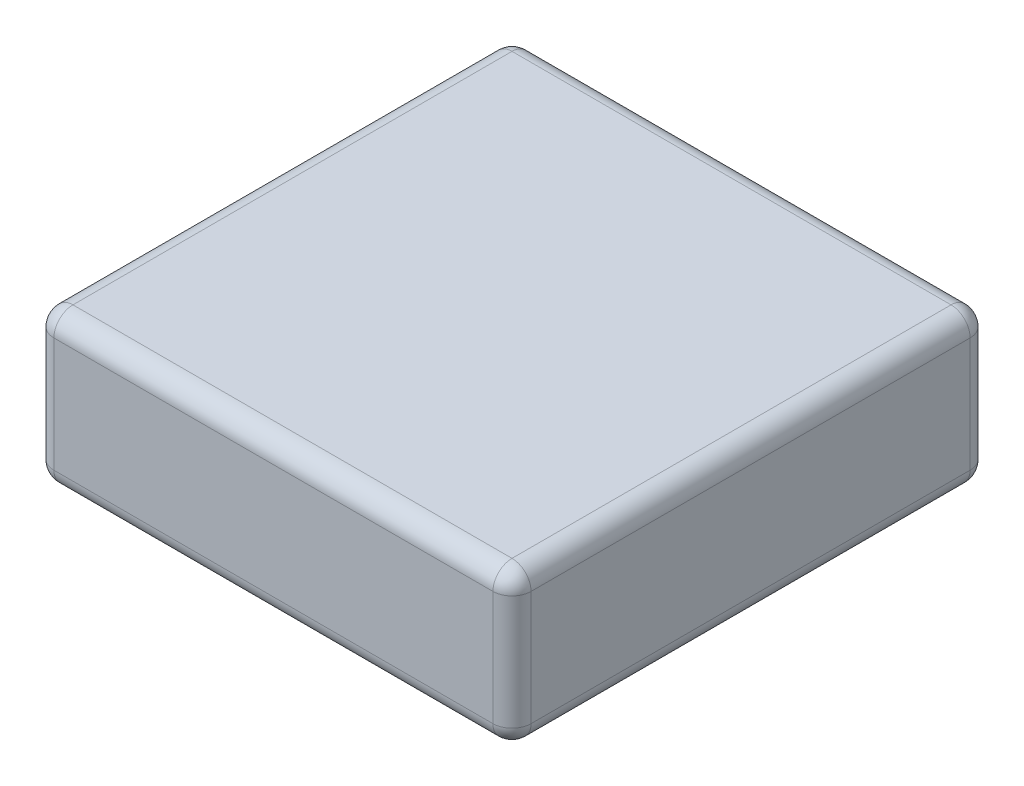
from build123d import *

# Parameters (mm, degrees)
SKETCH1_W           = 25
SKETCH1_H           = 25
BOSS_EXTRUDE1_DEPTH = 8
FILLET1_R           = 1


with BuildPart() as part:
    # Sketch1 → Boss-Extrude1 (new body)
    with BuildSketch(Plane(origin=(0, 0, 0), x_dir=(1, 0, 0), z_dir=(0, 1, 0))):
        Rectangle(SKETCH1_W, SKETCH1_H)
    extrude(amount=BOSS_EXTRUDE1_DEPTH)

    # Fillet1
    fillet1_edges = [part.edges().sort_by_distance(p)[0] for p in [
        (0, 0, 12.5),
        (12.5, 0, 0),
        (0, 0, -12.5),
        (-12.5, 0, 0),
        (0, 8, -12.5),
        (12.5, 8, 0),
        (0, 8, 12.5),
        (-12.5, 8, 0),
        (-12.5, 4, 12.5),
        (-12.5, 4, -12.5),
        (12.5, 4, 12.5),
        (12.5, 4, -12.5),
    ]]
    fillet(fillet1_edges, radius=FILLET1_R)


solid = part.part
